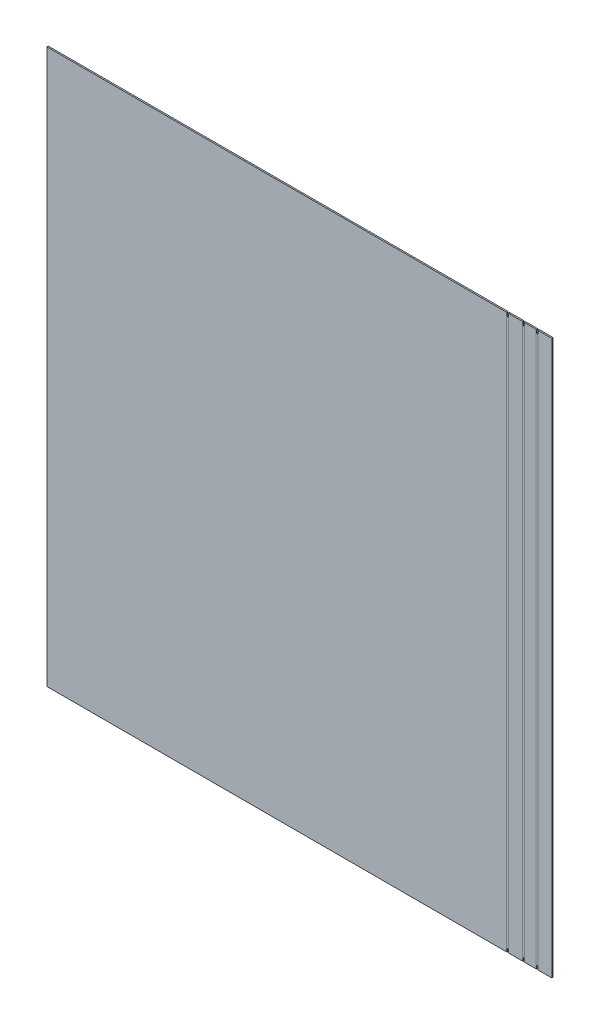
from build123d import *

# Parameters (mm, degrees)
BRIDA_BASE1_DEPTH          = 780
DESDOBLAR1_DEPTH           = 780
DESDOBLAR1_2_DEPTH         = 780
CORTAR_EXTRUIR1_DEPTH      = 871.255292724
CORTAR_EXTRUIR1_DEPTH_BACK = 871.255292724


# Read off the part's stored shape, not the designer's step: Desdoblar1
# Sheet-metal steps are written as plain solids
with BuildPart() as part:
    # Croquis55 → Brida base1 (new body)
    with BuildSketch(Plane(origin=(0, 0, 0), x_dir=(1, 0, 0), z_dir=(0, 1, 0))):
        with BuildLine():
            Line((-325, 0), (322.3634, 0))
            ThreePointArc((322.3634, 0), (324.227757739, -0.772242261), (325, -2.6366))
            Line((325, -2.6366), (325, -22.3634))
            ThreePointArc((325, -22.3634), (324.227757739, -24.227757739), (322.3634, -25))
            Line((322.3634, -25), (305.7366, -25))
            ThreePointArc((305.7366, -25), (305.215745145, -25.215745145), (305, -25.7366))
            Line((305, -25.7366), (305, -45))
            Line((305, -45), (303.1, -45))
            Line((303.1, -45), (303.1, -25.7366))
            ThreePointArc((303.1, -25.7366), (303.872242261, -23.872242261), (305.7366, -23.1))
            Line((305.7366, -23.1), (322.3634, -23.1))
            ThreePointArc((322.3634, -23.1), (322.884254855, -22.884254855), (323.1, -22.3634))
            Line((323.1, -22.3634), (323.1, -2.6366))
            ThreePointArc((323.1, -2.6366), (322.884254855, -2.115745145), (322.3634, -1.9))
            Line((322.3634, -1.9), (-325, -1.9))
            Line((-325, -1.9), (-325, 0))
        make_face()
    extrude(amount=BRIDA_BASE1_DEPTH)

    # Desdoblar1 outline → Desdoblar1 (cut)
    with BuildSketch(Plane(origin=(0, 0, 0), x_dir=(1, 0, 0), z_dir=(0, 1, 0))):
        with BuildLine():
            ThreePointArc((325, -2.6366), (324.973622072, -2.264578098), (324.895016084, -1.9))
            Line((324.895016084, -1.9), (322.3634, -1.9))
            ThreePointArc((322.3634, -1.9), (322.884254855, -2.115745145), (323.1, -2.6366))
            Line((323.1, -2.6366), (323.1, -22.3634))
            ThreePointArc((323.1, -22.3634), (322.884254855, -22.884254855), (322.3634, -23.1))
            Line((322.3634, -23.1), (305.7366, -23.1))
            ThreePointArc((305.7366, -23.1), (303.872242261, -23.872242261), (303.1, -25.7366))
            Line((303.1, -25.7366), (303.1, -45))
            Line((303.1, -45), (305, -45))
            Line((305, -45), (305, -25.7366))
            ThreePointArc((305, -25.7366), (305.215745145, -25.215745145), (305.7366, -25))
            Line((305.7366, -25), (322.3634, -25))
            ThreePointArc((322.3634, -25), (324.227757739, -24.227757739), (325, -22.3634))
            Line((325, -22.3634), (325, -2.6366))
        make_face()
    extrude(amount=DESDOBLAR1_DEPTH, mode=Mode.SUBTRACT)

    # Desdoblar1 2 outline → Desdoblar1 2 (add)
    with BuildSketch(Plane(origin=(0, 0, 0), x_dir=(1, 0, 0), z_dir=(0, 1, 0))):
        with BuildLine():
            Line((385.928315254, 0), (322.3634, 0))
            ThreePointArc((322.3634, 0), (323.946046517, -0.527835063), (324.895016084, -1.9))
            Line((324.895016084, -1.9), (385.928315254, -1.9))
            Line((385.928315254, -1.9), (385.928315254, 0))
        make_face()
    extrude(amount=DESDOBLAR1_2_DEPTH)

    # Croquis56 → Cortar-Extruir1 (cut, two sides: drawn at the far end of the back side and taken through both)
    with BuildSketch(Plane.XY.offset(1.9).offset(-CORTAR_EXTRUIR1_DEPTH_BACK)):
        with BuildLine():
            Line((322.688052542, 780), (322.688052542, 775.95))
            ThreePointArc((322.688052542, 775.95), (322.9663011, 775.278248558), (323.638052542, 775))
            Line((323.638052542, 775), (323.738052542, 775))
            ThreePointArc((323.738052542, 775), (324.409803985, 775.278248558), (324.688052542, 775.95))
            Line((324.688052542, 775.95), (324.688052542, 780))
            Line((324.688052542, 780), (322.688052542, 780))
        make_face()
        with BuildLine():
            Line((345.064157627, 780), (345.064157627, 775.95))
            ThreePointArc((345.064157627, 775.95), (345.342406185, 775.278248558), (346.014157627, 775))
            Line((346.014157627, 775), (346.114157627, 775))
            ThreePointArc((346.114157627, 775), (346.785909069, 775.278248558), (347.064157627, 775.95))
            Line((347.064157627, 775.95), (347.064157627, 780))
            Line((347.064157627, 780), (345.064157627, 780))
        make_face()
        with BuildLine():
            Line((364.340262712, 780), (364.340262712, 775.95))
            ThreePointArc((364.340262712, 775.95), (364.61851127, 775.278248558), (365.290262712, 775))
            Line((365.290262712, 775), (365.390262712, 775))
            ThreePointArc((365.390262712, 775), (366.062014154, 775.278248558), (366.340262712, 775.95))
            Line((366.340262712, 775.95), (366.340262712, 780))
            Line((366.340262712, 780), (364.340262712, 780))
        make_face()
        with BuildLine():
            Line((364.340262712, 0), (366.340262712, 0))
            Line((366.340262712, 0), (366.340262712, 4.05))
            ThreePointArc((366.340262712, 4.05), (366.062014154, 4.721751442), (365.390262712, 5))
            Line((365.390262712, 5), (365.290262712, 5))
            ThreePointArc((365.290262712, 5), (364.61851127, 4.721751442), (364.340262712, 4.05))
            Line((364.340262712, 4.05), (364.340262712, 0))
        make_face()
        with BuildLine():
            Line((345.064157627, 0), (347.064157627, 0))
            Line((347.064157627, 0), (347.064157627, 4.05))
            ThreePointArc((347.064157627, 4.05), (346.785909069, 4.721751442), (346.114157627, 5))
            Line((346.114157627, 5), (346.014157627, 5))
            ThreePointArc((346.014157627, 5), (345.342406185, 4.721751442), (345.064157627, 4.05))
            Line((345.064157627, 4.05), (345.064157627, 0))
        make_face()
        with BuildLine():
            Line((322.688052542, 0), (324.688052542, 0))
            Line((324.688052542, 0), (324.688052542, 4.05))
            ThreePointArc((324.688052542, 4.05), (324.409803985, 4.721751442), (323.738052542, 5))
            Line((323.738052542, 5), (323.638052542, 5))
            ThreePointArc((323.638052542, 5), (322.9663011, 4.721751442), (322.688052542, 4.05))
            Line((322.688052542, 4.05), (322.688052542, 0))
        make_face()
    extrude(amount=CORTAR_EXTRUIR1_DEPTH + CORTAR_EXTRUIR1_DEPTH_BACK, mode=Mode.SUBTRACT)


solid = part.part
